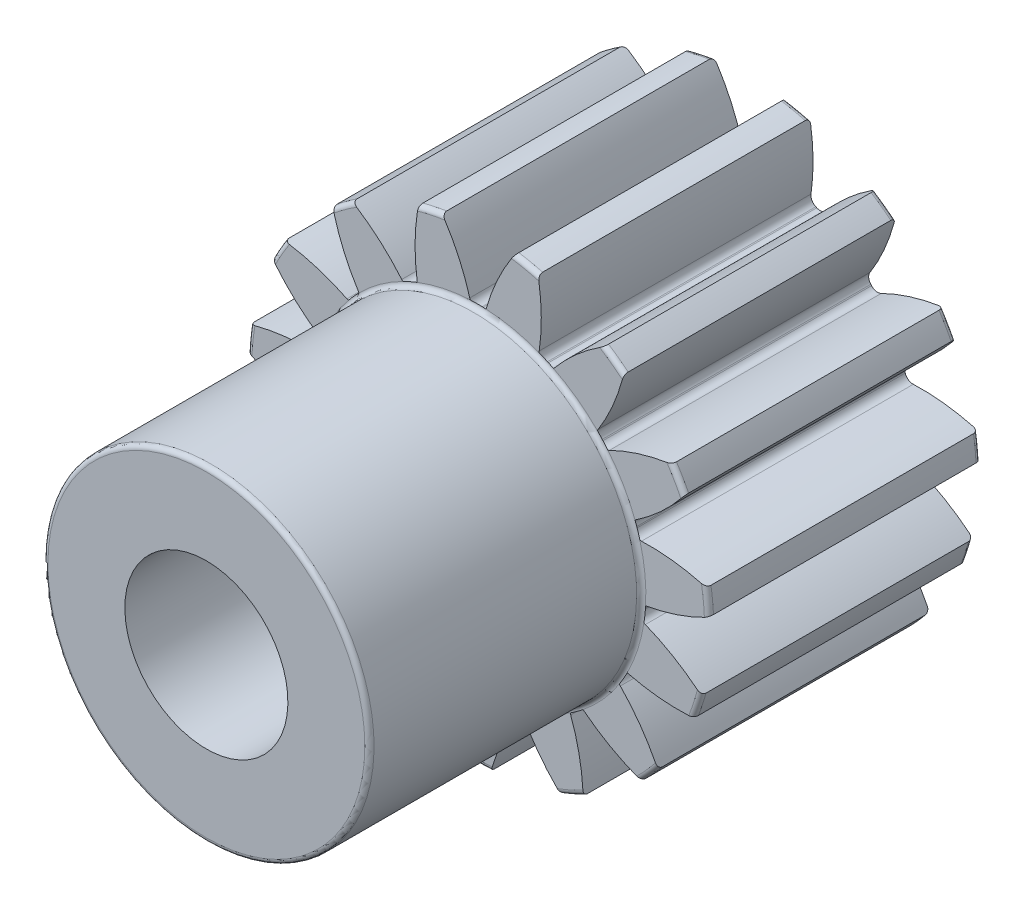
from build123d import *

# Parameters (mm, degrees)
FILLET2_R          = 0.17
CUT_EXTRUDE2_DEPTH = 16.636495771
CIRPATTERN1_COUNT  = 15


with BuildPart() as part:
    # Sketch4 → Revolve1 (revolve)
    with BuildSketch(Plane(origin=(0, 0, 0), x_dir=(0, 0, -1), z_dir=(1, 0, 0))):
        Polygon((-20, 3), (-20, 6), (-10, 6), (-10, 8.5), (0, 8.5), (0, 3), align=None)
    revolve(axis=Axis((0, 0, 10), (0, 0, 1)))

    # Fillet2
    fillet2_edges = [part.edges().sort_by_distance(p)[0] for p in [
        (0, -6, 20),
        (0, -6, 10),
        (0, -8.5, 10),
        (0, -8.5, 0),
    ]]
    fillet(fillet2_edges, radius=FILLET2_R)

    # Sketch7 → Cut-Extrude2 (cut, through all)
    with BuildSketch(Plane.XY.offset(10)):
        with BuildLine():
            ThreePointArc((-0.020030196, 5.999966566), (0, 6), (0.020030196, 5.999966566))
            ThreePointArc((0.020030196, 5.999966566), (0.201526835, 6.060331482), (0.309663012, 6.21810195))
            ThreePointArc((0.309663012, 6.21810195), (0.730954063, 7.347929647), (1.327861155, 8.395640819))
            ThreePointArc((1.327861155, 8.395640819), (0, 8.5), (-1.327861155, 8.395640819))
            ThreePointArc((-1.327861155, 8.395640819), (-0.730954063, 7.347929647), (-0.309663012, 6.21810195))
            ThreePointArc((-0.309663012, 6.21810195), (-0.201526835, 6.060331482), (-0.020030196, 5.999966566))
        make_face()
    cut_extrude2 = extrude(amount=-CUT_EXTRUDE2_DEPTH, mode=Mode.SUBTRACT)

    # CirPattern1: Cut-Extrude2 ×15 about axis
    cirpattern1_axis = Axis((0, 0, 20), (0, 0, -1))
    for i in range(1, CIRPATTERN1_COUNT):
        add(cut_extrude2.rotate(cirpattern1_axis, i * 360 / CIRPATTERN1_COUNT), mode=Mode.SUBTRACT)


solid = part.part
